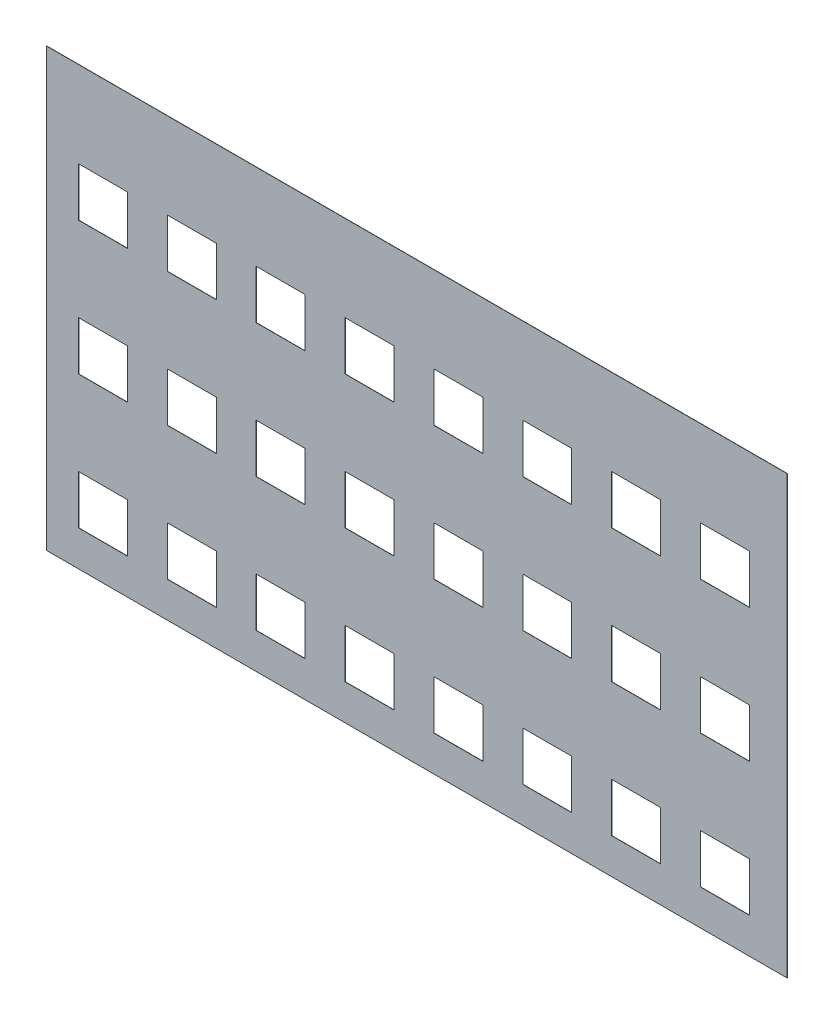
from build123d import *

# Parameters (mm, degrees)
MODEL_W             = 1870
MODEL_H             = 1180
BASE_FLANGE1_DEPTH  = 0.6
TAB1_DEPTH          = 0.6
SKETCH7_W           = 65
SKETCH7_H           = 1180
TAB2_DEPTH          = 0.6
SKETCH9_W           = 1840.328960488
SKETCH9_H           = 1045.942358838
BOSS_EXTRUDE1_DEPTH = 0.6
SKETCH8_W           = 132
SKETCH8_H           = 132
CUT_EXTRUDE1_DEPTH  = 10


# Sheet-metal steps are written as plain solids
with BuildPart() as part:
    # Model → Base-Flange1 (new body)
    with BuildSketch(Plane.XY):
        with Locations((935, 590)):
            Rectangle(MODEL_W, MODEL_H)
        Polygon((1790, 440), (1640, 440), (1640, 595), (1650, 595), (1650, 662), (1780, 662), (1780, 595), (1790, 595), align=None, mode=Mode.SUBTRACT)
        Polygon((1595, 440), (1445, 440), (1445, 595), (1455, 595), (1455, 662), (1585, 662), (1585, 595), (1595, 595), align=None, mode=Mode.SUBTRACT)
        Polygon((1400, 440), (1250, 440), (1250, 595), (1260, 595), (1260, 662), (1390, 662), (1390, 595), (1400, 595), align=None, mode=Mode.SUBTRACT)
        Polygon((1205, 440), (1055, 440), (1055, 595), (1065, 595), (1065, 662), (1195, 662), (1195, 595), (1205, 595), align=None, mode=Mode.SUBTRACT)
        Polygon((1010, 440), (860, 440), (860, 595), (870, 595), (870, 662), (1000, 662), (1000, 595), (1010, 595), align=None, mode=Mode.SUBTRACT)
        Polygon((815, 440), (665, 440), (665, 595), (675, 595), (675, 662), (805, 662), (805, 595), (815, 595), align=None, mode=Mode.SUBTRACT)
        Polygon((620, 440), (470, 440), (470, 595), (480, 595), (480, 662), (610, 662), (610, 595), (620, 595), align=None, mode=Mode.SUBTRACT)
        Polygon((425, 440), (275, 440), (275, 595), (285, 595), (285, 662), (415, 662), (415, 595), (425, 595), align=None, mode=Mode.SUBTRACT)
        Polygon((230, 440), (80, 440), (80, 595), (90, 595), (90, 662), (220, 662), (220, 595), (230, 595), align=None, mode=Mode.SUBTRACT)
        Polygon((1790, 805), (1640, 805), (1640, 960), (1650, 960), (1650, 1027), (1780, 1027), (1780, 960), (1790, 960), align=None, mode=Mode.SUBTRACT)
        Polygon((1595, 805), (1445, 805), (1445, 960), (1455, 960), (1455, 1027), (1585, 1027), (1585, 960), (1595, 960), align=None, mode=Mode.SUBTRACT)
        Polygon((1400, 805), (1250, 805), (1250, 960), (1260, 960), (1260, 1027), (1390, 1027), (1390, 960), (1400, 960), align=None, mode=Mode.SUBTRACT)
        Polygon((1205, 805), (1055, 805), (1055, 960), (1065, 960), (1065, 1027), (1195, 1027), (1195, 960), (1205, 960), align=None, mode=Mode.SUBTRACT)
        Polygon((1010, 805), (860, 805), (860, 960), (870, 960), (870, 1027), (1000, 1027), (1000, 960), (1010, 960), align=None, mode=Mode.SUBTRACT)
        Polygon((815, 805), (665, 805), (665, 960), (675, 960), (675, 1027), (805, 1027), (805, 960), (815, 960), align=None, mode=Mode.SUBTRACT)
        Polygon((620, 805), (470, 805), (470, 960), (480, 960), (480, 1027), (610, 1027), (610, 960), (620, 960), align=None, mode=Mode.SUBTRACT)
        Polygon((425, 805), (275, 805), (275, 960), (285, 960), (285, 1027), (415, 1027), (415, 960), (425, 960), align=None, mode=Mode.SUBTRACT)
        Polygon((230, 805), (80, 805), (80, 960), (90, 960), (90, 1027), (220, 1027), (220, 960), (230, 960), align=None, mode=Mode.SUBTRACT)
        Polygon((1790, 75), (1640, 75), (1640, 230), (1650, 230), (1650, 297), (1780, 297), (1780, 230), (1790, 230), align=None, mode=Mode.SUBTRACT)
        Polygon((1595, 75), (1445, 75), (1445, 230), (1455, 230), (1455, 297), (1585, 297), (1585, 230), (1595, 230), align=None, mode=Mode.SUBTRACT)
        Polygon((1400, 75), (1250, 75), (1250, 230), (1260, 230), (1260, 297), (1390, 297), (1390, 230), (1400, 230), align=None, mode=Mode.SUBTRACT)
        Polygon((1205, 75), (1055, 75), (1055, 230), (1065, 230), (1065, 297), (1195, 297), (1195, 230), (1205, 230), align=None, mode=Mode.SUBTRACT)
        Polygon((1010, 75), (860, 75), (860, 230), (870, 230), (870, 297), (1000, 297), (1000, 230), (1010, 230), align=None, mode=Mode.SUBTRACT)
        Polygon((815, 75), (665, 75), (665, 230), (675, 230), (675, 297), (805, 297), (805, 230), (815, 230), align=None, mode=Mode.SUBTRACT)
        Polygon((620, 75), (470, 75), (470, 230), (480, 230), (480, 297), (610, 297), (610, 230), (620, 230), align=None, mode=Mode.SUBTRACT)
        Polygon((425, 75), (275, 75), (275, 230), (285, 230), (285, 297), (415, 297), (415, 230), (425, 230), align=None, mode=Mode.SUBTRACT)
        Polygon((230, 75), (80, 75), (80, 230), (90, 230), (90, 297), (220, 297), (220, 230), (230, 230), align=None, mode=Mode.SUBTRACT)
    extrude(amount=-BASE_FLANGE1_DEPTH)

    # Sketch6 → Tab1 (add)
    with BuildSketch(Plane.XY):
        Polygon((1705, 805), (1725, 805), (1725, 806), (1789, 806), (1789, 959), (1779, 959), (1779, 1026), (1725, 1026), (1725, 1027), (1705, 1027), (1705, 1026), (1651, 1026), (1651, 959), (1641, 959), (1641, 806), (1705, 806), align=None)
        Polygon((1705, 440), (1725, 440), (1725, 441), (1789, 441), (1789, 594), (1779, 594), (1779, 661), (1725, 661), (1725, 662), (1705, 662), (1705, 661), (1651, 661), (1651, 594), (1641, 594), (1641, 441), (1705, 441), align=None)
        Polygon((1705, 75), (1725, 75), (1725, 76), (1789, 76), (1789, 229), (1779, 229), (1779, 296), (1725, 296), (1725, 297), (1705, 297), (1705, 296), (1651, 296), (1651, 229), (1641, 229), (1641, 76), (1705, 76), align=None)
    extrude(amount=-TAB1_DEPTH)

    # Sketch7 → Tab2 (add)
    with BuildSketch(Plane.XY):
        with Locations((1902.5, 590)):
            Rectangle(SKETCH7_W, SKETCH7_H)
        with Locations((-32.5, 590)):
            Rectangle(SKETCH7_W, SKETCH7_H)
    extrude(amount=-TAB2_DEPTH)

    # Sketch9 → Boss-Extrude1 (add)
    with BuildSketch(Plane.XY):
        with Locations((950.64470062, 555.573524784)):
            Rectangle(SKETCH9_W, SKETCH9_H)
    extrude(amount=-BOSS_EXTRUDE1_DEPTH)

    # Sketch8 → Cut-Extrude1 (cut)
    with BuildSketch(Plane.XY):
        with Locations((1767.05073242, 881.911611336)):
            Rectangle(SKETCH8_W, SKETCH8_H)
        with Locations((1527.05073242, 881.911611336)):
            Rectangle(SKETCH8_W, SKETCH8_H)
        with Locations((1287.05073242, 881.911611336)):
            Rectangle(SKETCH8_W, SKETCH8_H)
        with Locations((1047.05073242, 881.911611336)):
            Rectangle(SKETCH8_W, SKETCH8_H)
        with Locations((807.05073242, 881.911611336)):
            Rectangle(SKETCH8_W, SKETCH8_H)
        with Locations((567.05073242, 881.911611336)):
            Rectangle(SKETCH8_W, SKETCH8_H)
        with Locations((327.05073242, 881.911611336)):
            Rectangle(SKETCH8_W, SKETCH8_H)
        with Locations((87.05073242, 881.911611336)):
            Rectangle(SKETCH8_W, SKETCH8_H)
        with Locations((1527.05073242, 521.911611336)):
            Rectangle(SKETCH8_W, SKETCH8_H)
        with Locations((1287.05073242, 521.911611336)):
            Rectangle(SKETCH8_W, SKETCH8_H)
        with Locations((1047.05073242, 521.911611336)):
            Rectangle(SKETCH8_W, SKETCH8_H)
        with Locations((807.05073242, 521.911611336)):
            Rectangle(SKETCH8_W, SKETCH8_H)
        with Locations((567.05073242, 521.911611336)):
            Rectangle(SKETCH8_W, SKETCH8_H)
        with Locations((327.05073242, 521.911611336)):
            Rectangle(SKETCH8_W, SKETCH8_H)
        with Locations((87.05073242, 521.911611336)):
            Rectangle(SKETCH8_W, SKETCH8_H)
        with Locations((1527.05073242, 161.911611336)):
            Rectangle(SKETCH8_W, SKETCH8_H)
        with Locations((1287.05073242, 161.911611336)):
            Rectangle(SKETCH8_W, SKETCH8_H)
        with Locations((1047.05073242, 161.911611336)):
            Rectangle(SKETCH8_W, SKETCH8_H)
        with Locations((807.05073242, 161.911611336)):
            Rectangle(SKETCH8_W, SKETCH8_H)
        with Locations((567.05073242, 161.911611336)):
            Rectangle(SKETCH8_W, SKETCH8_H)
        with Locations((327.05073242, 161.911611336)):
            Rectangle(SKETCH8_W, SKETCH8_H)
        with Locations((87.05073242, 161.911611336)):
            Rectangle(SKETCH8_W, SKETCH8_H)
        with Locations((1767.05073242, 521.911611336)):
            Rectangle(SKETCH8_W, SKETCH8_H)
        with Locations((1767.05073242, 161.911611336)):
            Rectangle(SKETCH8_W, SKETCH8_H)
    extrude(amount=-CUT_EXTRUDE1_DEPTH, mode=Mode.SUBTRACT)


solid = part.part
